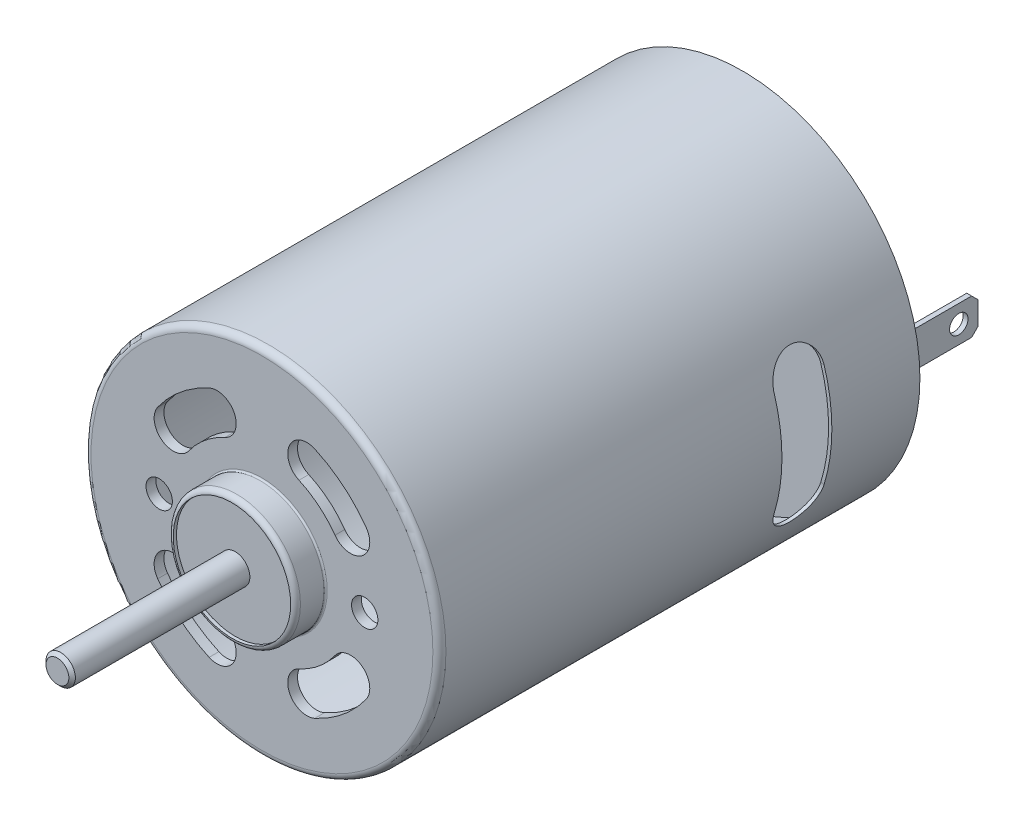
from build123d import *

# Parameters (mm, degrees)
SKETCH1_R                    = 13.8176
EXTRUDE1_DEPTH               = 37.4142
FILLET1_R                    = 0.508
SKETCH2_R                    = 4.953
EXTRUDE2_DEPTH               = 2.3368
FILLET2_R                    = 0.381
SKETCH3_R                    = 1.143
EXTRUDE3_DEPTH               = 13.589
CHAMFER1_SIZE                = 0.254
M2_5X0_45_TAPPED_HOLE1_D     = 2.05
M2_5X0_45_TAPPED_HOLE1_DEPTH = 2.54
M2_5X0_45_TAPPED_HOLE1_TIP   = 0.615882135
CUT_EXTRUDE1_DEPTH           = 2.54
SKETCH7_R                    = 13.5636
CUT_EXTRUDE2_DEPTH           = 34.327184135
CUT_EXTRUDE3_DEPTH           = 25.4
EXTRUDE4_START               = 2.921
SKETCH9_R                    = 4.953
EXTRUDE4_DEPTH               = 2.921
SKETCH10_R                   = 4.735790285
SKETCH10_R_2                 = 1.143
CUT_EXTRUDE4_DEPTH           = 0.508
CUT_EXTRUDE5_START           = -0.254
SKETCH11_R                   = 13.5636
SKETCH11_R_2                 = 9.525
CUT_EXTRUDE5_DEPTH           = 0.254
FILLET3_R                    = 0.127
SKETCH12_W                   = 0.381
SKETCH12_H                   = 2.794
EXTRUDE5_DEPTH               = 6.9088
CHAMFER2_SIZE                = 0.4953
SKETCH13_R                   = 0.718992638
CUT_EXTRUDE6_DEPTH           = 25.4
SKETCH14_W                   = 0.4826
SKETCH14_H                   = 2.8956
EXTRUDE6_DEPTH               = 0.635
EXTRUDE6_DRAFT               = 2
FILLET5_R                    = 0.0508
MIRROR2_COPY_1_SKETCH_W      = 0.4826
MIRROR2_COPY_1_SKETCH_H      = 2.8956
MIRROR2_COPY_1_DEPTH         = 0.635
MIRROR2_COPY_1_DRAFT         = 2
FILLET5_OF_MIRROR2_R         = 0.0508
CHAMFER3_SIZE                = 0.127
CUT_EXTRUDE7_START           = -0.254
SKETCH15_R                   = 4.572
SKETCH15_R_2                 = 1.143
CUT_EXTRUDE7_DEPTH           = 0.254
SCALE1_SCALE                 = 3


with BuildPart() as part:
    # Sketch1 → Extrude1 (new body)
    with BuildSketch(Plane.XY):
        Circle(SKETCH1_R)
    extrude(amount=-EXTRUDE1_DEPTH)

    # Fillet1
    fillet1_edges = [part.edges().sort_by_distance(p)[0] for p in [
        (-13.8176, 0, 0),
    ]]
    fillet(fillet1_edges, radius=FILLET1_R)

    # Sketch2 → Extrude2 (add)
    with BuildSketch(Plane.XY):
        Circle(SKETCH2_R)
    extrude(amount=EXTRUDE2_DEPTH)

    # Fillet2
    fillet2_edges = [part.edges().sort_by_distance(p)[0] for p in [
        (-4.953, 0, 2.3368),
    ]]
    fillet(fillet2_edges, radius=FILLET2_R)

    # Sketch3 → Extrude3 (add)
    with BuildSketch(Plane.XY.offset(2.3368)):
        Circle(SKETCH3_R)
    extrude(amount=EXTRUDE3_DEPTH)

    # Chamfer1
    chamfer1_edges = [part.edges().sort_by_distance(p)[0] for p in [
        (-1.143, 0, 15.9258),
    ]]
    chamfer(chamfer1_edges, length=CHAMFER1_SIZE)

    # M2.5x0.45 Tapped Hole1
    with Locations(Plane.XY):
        with Locations((-8.001, 0), (8.001, 0)):
            Hole(M2_5X0_45_TAPPED_HOLE1_D / 2, depth=M2_5X0_45_TAPPED_HOLE1_DEPTH)
            with Locations((0, 0, -(M2_5X0_45_TAPPED_HOLE1_DEPTH + M2_5X0_45_TAPPED_HOLE1_TIP / 2))):  # 118° drill point
                Cone(0, M2_5X0_45_TAPPED_HOLE1_D / 2, M2_5X0_45_TAPPED_HOLE1_TIP, mode=Mode.SUBTRACT)

    # Sketch6 → Cut-Extrude1 (cut)
    with BuildSketch(Plane.XY):
        with BuildLine():
            ThreePointArc((5.687486593, 4.054962547), (4.437796172, 5.394088443), (2.882947566, 6.362298196))
            ThreePointArc((2.882947566, 6.362298196), (2.139631749, 8.337418881), (4.114752434, 9.080734698))
            ThreePointArc((4.114752434, 9.080734698), (6.333945446, 7.698835324), (8.117594501, 5.787537453))
            ThreePointArc((8.117594501, 5.787537453), (7.768828, 3.706196046), (5.687486593, 4.054962547))
        make_face()
        with BuildLine():
            ThreePointArc((-5.687486593, 4.054962547), (-7.768828, 3.706196046), (-8.117594501, 5.787537453))
            ThreePointArc((-8.117594501, 5.787537453), (-6.333945446, 7.698835324), (-4.114752434, 9.080734698))
            ThreePointArc((-4.114752434, 9.080734698), (-2.139631749, 8.337418881), (-2.882947566, 6.362298196))
            ThreePointArc((-2.882947566, 6.362298196), (-4.437796172, 5.394088443), (-5.687486593, 4.054962547))
        make_face()
        with BuildLine():
            ThreePointArc((-5.687486593, -4.054962547), (-7.768828, -3.706196046), (-8.117594501, -5.787537453))
            ThreePointArc((-8.117594501, -5.787537453), (-6.333945446, -7.698835324), (-4.114752434, -9.080734698))
            ThreePointArc((-4.114752434, -9.080734698), (-2.139631749, -8.337418881), (-2.882947566, -6.362298196))
            ThreePointArc((-2.882947566, -6.362298196), (-4.437796172, -5.394088443), (-5.687486593, -4.054962547))
        make_face()
        with BuildLine():
            ThreePointArc((4.114752434, -9.080734698), (2.139631749, -8.337418881), (2.882947566, -6.362298196))
            ThreePointArc((2.882947566, -6.362298196), (4.437796172, -5.394088443), (5.687486593, -4.054962547))
            ThreePointArc((5.687486593, -4.054962547), (7.768828, -3.706196046), (8.117594501, -5.787537453))
            ThreePointArc((8.117594501, -5.787537453), (6.333945446, -7.698835324), (4.114752434, -9.080734698))
        make_face()
    extrude(amount=-CUT_EXTRUDE1_DEPTH, mode=Mode.SUBTRACT)

    # Sketch7 → Cut-Extrude2 (cut)
    with BuildSketch(Plane.XY.offset(-0.762)):
        Circle(SKETCH7_R)
    extrude(amount=-CUT_EXTRUDE2_DEPTH, mode=Mode.SUBTRACT)

    # Sketch8 → Cut-Extrude3 (cut, symmetric)
    with BuildSketch(Plane(origin=(0, 0, 0), x_dir=(0, 0, -1), z_dir=(1, 0, 0))):
        with BuildLine():
            Line((26.67, 4.0259), (26.67, -4.0259))
            ThreePointArc((26.67, -4.0259), (28.6131, -5.969), (30.5562, -4.0259))
            Line((30.5562, -4.0259), (30.5562, 4.0259))
            ThreePointArc((30.5562, 4.0259), (28.6131, 5.969), (26.67, 4.0259))
        make_face()
    extrude(amount=CUT_EXTRUDE3_DEPTH, both=True, mode=Mode.SUBTRACT)

    # Sketch9 → Extrude4 (add)
    with BuildSketch(Plane(origin=(0, 0, -37.4142), x_dir=(-1, 0, 0), z_dir=(0, 0, -1)).offset(EXTRUDE4_START)):
        with Locations(Location((0, 0, 0), (0, 0, 180))):
            Circle(SKETCH9_R)
    extrude(amount=-EXTRUDE4_DEPTH)

    # Sketch10 → Cut-Extrude4 (cut)
    with BuildSketch(Plane(origin=(0, 0, -40.3352), x_dir=(-1, 0, 0), z_dir=(0, 0, -1))):
        Circle(SKETCH10_R)
        with Locations(Location((0, 0, 0), (0, 0, 180))):
            Circle(SKETCH10_R_2, mode=Mode.SUBTRACT)
    extrude(amount=-CUT_EXTRUDE4_DEPTH, mode=Mode.SUBTRACT)

    # Sketch11 → Cut-Extrude5 (cut)
    with BuildSketch(Plane(origin=(0, 0, -37.4142), x_dir=(-1, 0, 0), z_dir=(0, 0, -1)).offset(CUT_EXTRUDE5_START)):
        with Locations(Location((0, 0, 0), (0, 0, 180))):
            Circle(SKETCH11_R)
        Circle(SKETCH11_R_2, mode=Mode.SUBTRACT)
    extrude(amount=CUT_EXTRUDE5_DEPTH, mode=Mode.SUBTRACT)

    # Fillet3
    fillet3_edges = [part.edges().sort_by_distance(p)[0] for p in [
        (-4.953, 0, -37.4142),
        (9.525, 0, -37.1602),
        (9.525, 0, -37.4142),
        (-4.953, 0, 0),
    ]]
    fillet(fillet3_edges, radius=FILLET3_R - 0.0001)  # a hair under: the kernel refuses the full size

    # Sketch12 → Extrude5 (add)
    with BuildSketch(Plane(origin=(0, 0, -37.1602), x_dir=(-1, 0, 0), z_dir=(0, 0, -1))):
        with Locations((11.4935, 0)):
            Rectangle(SKETCH12_W, SKETCH12_H)
    extrude5 = extrude(amount=EXTRUDE5_DEPTH)

    # Mirror1: Extrude5 across plane
    add(extrude5.mirror(Plane(origin=(0, 0, 0), x_dir=(0, 0, 1), z_dir=(1, 0, 0))))

    # Chamfer2
    chamfer2_edges = [part.edges().sort_by_distance(p)[0] for p in [
        (-11.4935, -1.397, -44.069),
        (-11.4935, 1.397, -44.069),
        (11.4935, 1.397, -44.069),
        (11.4935, -1.397, -44.069),
    ]]
    chamfer(chamfer2_edges, length=CHAMFER2_SIZE)

    # Sketch13 → Cut-Extrude6 (cut, symmetric)
    with BuildSketch(Plane(origin=(0, 0, 0), x_dir=(0, 0, -1), z_dir=(1, 0, 0))):
        with Locations((42.574522445, 0)):
            Circle(SKETCH13_R)
    extrude(amount=CUT_EXTRUDE6_DEPTH, both=True, mode=Mode.SUBTRACT)


with BuildPart() as extrude6_tool:
    # Sketch14 → Extrude6 (with draft: the straight prism first)
    with BuildSketch(Plane(origin=(0, 0, -37.1602), x_dir=(-1, 0, 0), z_dir=(0, 0, -1))):
        with BuildLine():
            Line((11.938, -1.524), (11.938, 1.524))
            ThreePointArc((11.938, 1.524), (11.900802561, 1.613802561), (11.811, 1.651))
            Line((11.811, 1.651), (11.176, 1.651))
            ThreePointArc((11.176, 1.651), (11.086197439, 1.613802561), (11.049, 1.524))
            Line((11.049, 1.524), (11.049, -1.524))
            ThreePointArc((11.049, -1.524), (11.086197439, -1.613802561), (11.176, -1.651))
            Line((11.176, -1.651), (11.811, -1.651))
            ThreePointArc((11.811, -1.651), (11.900802561, -1.613802561), (11.938, -1.524))
        make_face()
        with Locations((11.4935, 0)):
            Rectangle(SKETCH14_W, SKETCH14_H, mode=Mode.SUBTRACT)
    extrude(amount=EXTRUDE6_DEPTH)
    # Extrude6: the draft: its side faces are tilted about the plane it starts from
    extrude6_sides = [extrude6_tool.faces().sort_by_distance(p)[0] for p in [
        (-11.4935, -1.651, -37.4777),
        (-11.900802561, -1.613802561, -37.4777),
        (-11.938, 0, -37.4777),
        (-11.900802561, 1.613802561, -37.4777),
        (-11.4935, 1.651, -37.4777),
        (-11.086197439, 1.613802561, -37.4777),
        (-11.049, 0, -37.4777),
        (-11.086197439, -1.613802561, -37.4777),
        (-11.2522, 0, -37.4777),
        (-11.4935, 1.4478, -37.4777),
        (-11.7348, 0, -37.4777),
        (-11.4935, -1.4478, -37.4777),
    ]]
    draft(extrude6_sides, Plane(origin=(0, 0, -37.1602), x_dir=(-1, 0, 0), z_dir=(0, 0, -1)), EXTRUDE6_DRAFT)


with BuildPart() as part_1:
    add(part.part)

    # Extrude6: add extrude6_tool
    add(extrude6_tool.part)

    # Fillet5
    fillet5_edges = [part_1.edges().sort_by_distance(p)[0] for p in [
        (-11.885122689, 1.598122689, -37.7952),
        (-11.4935, 1.628825311, -37.7952),
        (-11.101877311, 1.598122689, -37.7952),
        (-11.071174689, 0, -37.7952),
        (-11.101877311, -1.598122689, -37.7952),
        (-11.4935, -1.628825311, -37.7952),
        (-11.885122689, -1.598122689, -37.7952),
        (-11.915825311, 0, -37.7952),
        (-11.230025311, 0, -37.7952),
        (-11.4935, -1.469974689, -37.7952),
        (-11.756974689, 0, -37.7952),
        (-11.4935, 1.469974689, -37.7952),
    ]]
    fillet(fillet5_edges, radius=FILLET5_R)


with BuildPart() as mirror2_copy_1_tool:
    # Mirror2 copy 1 sketch → Mirror2 copy 1 (with draft: the straight prism first)
    with BuildSketch(Plane(origin=(0, 0, -37.1602), x_dir=(1, 0, 0), z_dir=(0, 0, -1))):
        with BuildLine():
            Line((11.938, 1.524), (11.938, -1.524))
            ThreePointArc((11.938, -1.524), (11.900802561, -1.613802561), (11.811, -1.651))
            Line((11.811, -1.651), (11.176, -1.651))
            ThreePointArc((11.176, -1.651), (11.086197439, -1.613802561), (11.049, -1.524))
            Line((11.049, -1.524), (11.049, 1.524))
            ThreePointArc((11.049, 1.524), (11.086197439, 1.613802561), (11.176, 1.651))
            Line((11.176, 1.651), (11.811, 1.651))
            ThreePointArc((11.811, 1.651), (11.900802561, 1.613802561), (11.938, 1.524))
        make_face()
        with Locations((11.4935, 0)):
            Rectangle(MIRROR2_COPY_1_SKETCH_W, MIRROR2_COPY_1_SKETCH_H, mode=Mode.SUBTRACT)
    extrude(amount=MIRROR2_COPY_1_DEPTH)
    # Mirror2 copy 1: the draft: its side faces are tilted about the plane it starts from
    mirror2_copy_1_sides = [mirror2_copy_1_tool.faces().sort_by_distance(p)[0] for p in [
        (11.4935, -1.651, -37.4777),
        (11.900802561, -1.613802561, -37.4777),
        (11.938, 0, -37.4777),
        (11.900802561, 1.613802561, -37.4777),
        (11.4935, 1.651, -37.4777),
        (11.086197439, 1.613802561, -37.4777),
        (11.049, 0, -37.4777),
        (11.086197439, -1.613802561, -37.4777),
        (11.2522, 0, -37.4777),
        (11.4935, 1.4478, -37.4777),
        (11.7348, 0, -37.4777),
        (11.4935, -1.4478, -37.4777),
    ]]
    draft(mirror2_copy_1_sides, Plane(origin=(0, 0, -37.1602), x_dir=(1, 0, 0), z_dir=(0, 0, -1)), MIRROR2_COPY_1_DRAFT)


with BuildPart() as part_2:
    add(part_1.part)

    # Mirror2 copy 1: add mirror2_copy_1_tool
    add(mirror2_copy_1_tool.part)

    # Fillet5 of Mirror2
    fillet5_of_mirror2_edges = [part_2.edges().sort_by_distance(p)[0] for p in [
        (11.885122689, 1.598122689, -37.7952),
        (11.4935, 1.628825311, -37.7952),
        (11.101877311, 1.598122689, -37.7952),
        (11.071174689, 0, -37.7952),
        (11.101877311, -1.598122689, -37.7952),
        (11.4935, -1.628825311, -37.7952),
        (11.885122689, -1.598122689, -37.7952),
        (11.915825311, 0, -37.7952),
        (11.230025311, 0, -37.7952),
        (11.4935, -1.469974689, -37.7952),
        (11.756974689, 0, -37.7952),
        (11.4935, 1.469974689, -37.7952),
    ]]
    fillet(fillet5_of_mirror2_edges, radius=FILLET5_OF_MIRROR2_R)

    # Chamfer3
    chamfer3_edges = [part_2.edges().sort_by_distance(p)[0] for p in [
        (-1.143, 0, -40.3352),
    ]]
    chamfer(chamfer3_edges, length=CHAMFER3_SIZE)

    # Sketch15 → Cut-Extrude7 (cut)
    with BuildSketch(Plane.XY.offset(2.3368).offset(CUT_EXTRUDE7_START)):
        Circle(SKETCH15_R)
        with Locations(Location((0, 0, 0), (0, 0, 180))):
            Circle(SKETCH15_R_2, mode=Mode.SUBTRACT)
    extrude(amount=CUT_EXTRUDE7_DEPTH, mode=Mode.SUBTRACT)


with BuildPart() as part_3:
    # Scale1: scaled about (-1.4e-08, 1e-09, -23.805557963)
    add(part_2.part.scale(SCALE1_SCALE).moved(Location((2.8e-08, -2e-09, 47.611115926))))


solid = part_3.part
